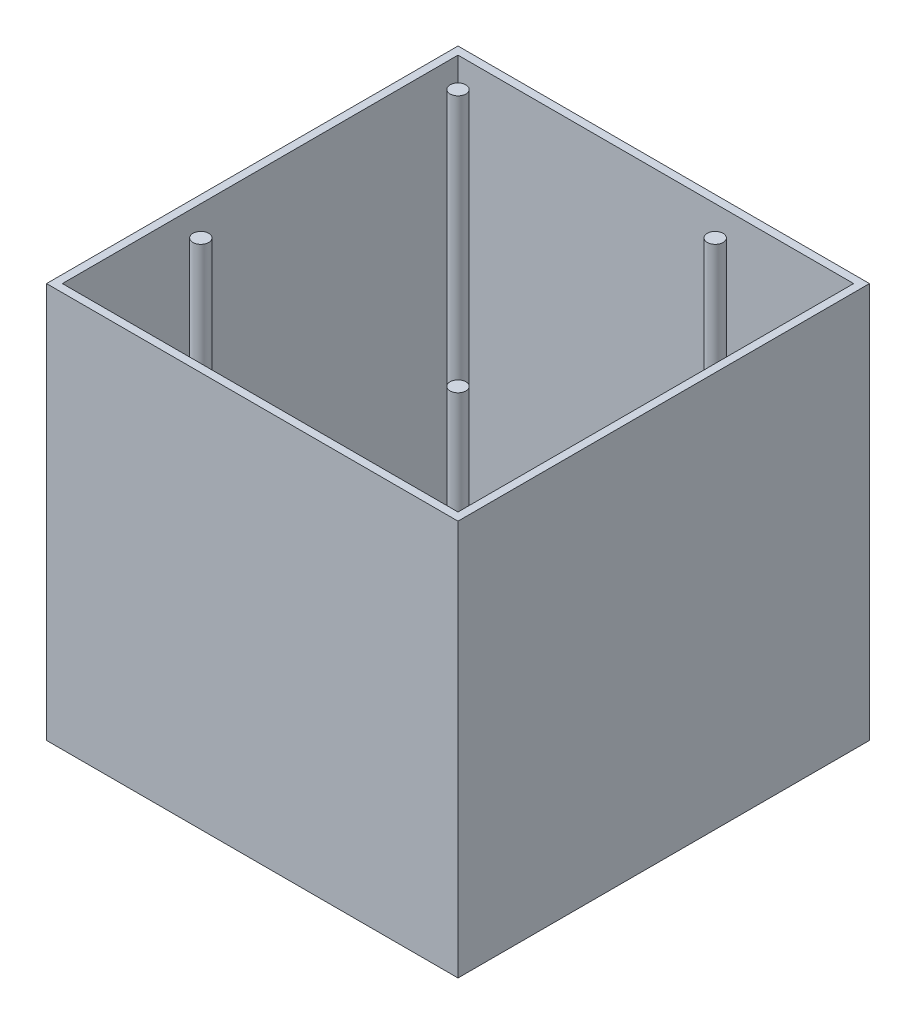
from build123d import *

# Parameters (mm, degrees)
SKETCH1_W                                  = 208
SKETCH1_H                                  = 208
SKETCH1_W_2                                = 200
SKETCH1_H_2                                = 200
BOSS_EXTRUDE1_DEPTH                        = 200
SKETCH3_W                                  = 40
SKETCH3_H                                  = 80
CUT_EXTRUDE1_DEPTH                         = 249.257930387
SKETCH4_W                                  = 144
SKETCH4_H                                  = 144
BOSS_EXTRUDE3_DEPTH                        = 5
BOSS_EXTRUDE4_DEPTH                        = 5
SKETCH4_5_R                                = 4
BOSS_EXTRUDE5_DEPTH                        = 210
BOSS_EXTRUDE5_DIRECTION_2_REACH            = 242.275
MIRROR2_OUTLINE_R                          = 4
MIRROR2_DEPTH                              = 220
MIRROR2_2_OUTLINE_R                        = 4
MIRROR2_2_DEPTH                            = 5
SKETCH8_R                                  = 10
BOSS_EXTRUDE7_DEPTH                        = 25
CUT_EXTRUDE3_DEPTH                         = 265.635598512
CUT_EXTRUDE3_DEPTH_BACK                    = 265.635598512
SKETCH11_R                                 = 5
CUT_EXTRUDE4_DEPTH                         = 245.247824965
SKETCH12_R                                 = 4.3
CUT_EXTRUDE5_DEPTH                         = 257.382526706
MIRROR3_AT_THE_SECOND_PLANE_COPY_1_SKETC_R = 4.3
MIRROR3_AT_THE_SECOND_PLANE_COPY_1_DEPTH   = 257.382526706


# Read off the part's stored shape, not the designer's step: Mirror2
with BuildPart() as part:
    # Sketch1 → Boss-Extrude1 (new body)
    with BuildSketch(Plane(origin=(0, 0, 0), x_dir=(1, 0, 0), z_dir=(0, 1, 0))):
        Rectangle(SKETCH1_W, SKETCH1_H)
        Rectangle(SKETCH1_W_2, SKETCH1_H_2, mode=Mode.SUBTRACT)
    extrude(amount=BOSS_EXTRUDE1_DEPTH)

    # Sketch3 → Cut-Extrude1 (cut, through all)
    with BuildSketch(Plane.XY):
        with Locations((0, 40)):
            Rectangle(SKETCH3_W, SKETCH3_H)
    extrude(amount=-CUT_EXTRUDE1_DEPTH, mode=Mode.SUBTRACT)

    # Sketch5 → Boss-Extrude4 (add)
    with BuildSketch(Plane(origin=(0, 0, 0), x_dir=(1, 0, 0), z_dir=(0, 1, 0))):
        with BuildLine():
            Line((90, 100), (59.468591297, 70.779577645))
            ThreePointArc((59.468591297, 70.779577645), (59.343145751, 59.343145751), (70.779577645, 59.468591297))
            Line((70.779577645, 59.468591297), (100, 90))
            Line((100, 90), (100, 100))
            Line((100, 100), (90, 100))
        make_face()
    extrude(amount=BOSS_EXTRUDE4_DEPTH)

    # Sketch4<5> → Boss-Extrude5 (add)
    with BuildSketch(Plane(origin=(0, 10, 0), x_dir=(1, 0, 0), z_dir=(0, 1, 0))):
        with Locations(Location((65, 65, 0), (0, 0, 270))):
            Circle(SKETCH4_5_R)
    extrude(amount=BOSS_EXTRUDE5_DEPTH)

    # Sketch4<5> → Boss-Extrude5 direction 2 (add, up to next)
    with BuildSketch(Plane(origin=(0, 10, 0), x_dir=(1, 0, 0), z_dir=(0, 1, 0)), mode=Mode.PRIVATE) as boss_extrude5_direction_2_sk1:
        with Locations(Location((65, 65, 0), (0, 0, 270))):
            Circle(SKETCH4_5_R)
    boss_extrude5_direction_2_tool1 = extrude(boss_extrude5_direction_2_sk1.sketch, amount=-BOSS_EXTRUDE5_DIRECTION_2_REACH, mode=Mode.PRIVATE) - part.part
    add(boss_extrude5_direction_2_tool1.solids().sort_by_distance((65, 10, -65))[0])



with BuildPart() as body_2:
    # Sketch4 → Boss-Extrude3 (new body)
    with BuildSketch(Plane(origin=(0, 10, 0), x_dir=(1, 0, 0), z_dir=(0, 1, 0))):
        Rectangle(SKETCH4_W, SKETCH4_H)
    extrude(amount=-BOSS_EXTRUDE3_DEPTH)

    # Sketch8 → Boss-Extrude7 (add, through all)
    with BuildSketch(Plane(origin=(0, 25, 0), x_dir=(1, 0, 0), z_dir=(0, 1, 0))):
        with Locations((0, 82)):
            Circle(SKETCH8_R)
        with BuildLine():
            Line((-10, 82), (-10, 57))
            Line((-10, 57), (10, 57))
            Line((10, 57), (10, 82))
            ThreePointArc((10, 82), (0, 72), (-10, 82))
        make_face()
    extrude(amount=-BOSS_EXTRUDE7_DEPTH)

    # Sketch10 → Cut-Extrude3 (cut, two sides: drawn at the far end of the back side and taken through both)
    with BuildSketch(Plane(origin=(0, 0, 0), x_dir=(0, 0, -1), z_dir=(1, 0, 0)).offset(-CUT_EXTRUDE3_DEPTH_BACK)):
        Polygon((665.474932894, 20), (92, 20), (72, 20), (72, 0), (72, -573.474932894), (883.01602778, -1384.490960674), (1476.490960674, -791.01602778), align=None)
    extrude(amount=CUT_EXTRUDE3_DEPTH + CUT_EXTRUDE3_DEPTH_BACK, mode=Mode.SUBTRACT)

    # Sketch11 → Cut-Extrude4 (cut, through all)
    with BuildSketch(Plane(origin=(0, 25, 0), x_dir=(1, 0, 0), z_dir=(0, 1, 0))):
        with Locations(Location((0, 82, 0), (0, 0, 270))):
            Circle(SKETCH11_R)
    extrude(amount=-CUT_EXTRUDE4_DEPTH, mode=Mode.SUBTRACT)

    # Sketch12 → Cut-Extrude5 (cut, through all)
    with BuildSketch(Plane(origin=(0, 10, 0), x_dir=(1, 0, 0), z_dir=(0, 1, 0))):
        with Locations(Location((65, 65, 0), (0, 0, 270))):
            Circle(SKETCH12_R)
    cut_extrude5 = extrude(amount=-CUT_EXTRUDE5_DEPTH, mode=Mode.SUBTRACT)

    # Mirror3: Cut-Extrude5 across plane
    add(cut_extrude5.mirror(Plane.XY), mode=Mode.SUBTRACT)

    # Mirror3 at the second plane: Cut-Extrude5 across plane
    add(cut_extrude5.mirror(Plane(origin=(0, 0, 0), x_dir=(0, 0, 1), z_dir=(1, 0, 0))), mode=Mode.SUBTRACT)

    # Mirror3 at the second plane copy 1 sketc → Mirror3 at the second plane copy 1 (cut, through all)
    with BuildSketch(Plane(origin=(0, 10, 0), x_dir=(-1, 0, 0), z_dir=(0, 1, 0))):
        with Locations(Location((65, 65, 0), (0, 0, 270))):
            Circle(MIRROR3_AT_THE_SECOND_PLANE_COPY_1_SKETC_R)
    extrude(amount=-MIRROR3_AT_THE_SECOND_PLANE_COPY_1_DEPTH, mode=Mode.SUBTRACT)


with BuildPart() as body_3:
    # Mirror2 outline → Mirror2 (new body)
    with BuildSketch(Plane(origin=(0, 0, 0), x_dir=(1, 0, 0), z_dir=(0, 1, 0))):
        with Locations((65, -65)):
            Circle(MIRROR2_OUTLINE_R)
        with Locations((-65, 65)):
            Circle(MIRROR2_OUTLINE_R)
        with Locations((-65, -65)):
            Circle(MIRROR2_OUTLINE_R)
    extrude(amount=MIRROR2_DEPTH)


with BuildPart() as part_1:
    add(part.part)

    add(body_3.part)  # Mirror2 2 merges body 3
    # Mirror2 2 outline → Mirror2 2 (add)
    # profile 1 of 3: a face of its own
    with BuildSketch(Plane(origin=(0, 0, 0), x_dir=(1, 0, 0), z_dir=(0, 1, 0))):
        with BuildLine():
            ThreePointArc((70.779577645, -59.468591297), (59.343145751, -59.343145751), (59.468591297, -70.779577645))
            Line((59.468591297, -70.779577645), (90, -100))
            Line((90, -100), (100, -100))
            Line((100, -100), (100, -90))
            Line((100, -90), (70.779577645, -59.468591297))
        make_face()
        with Locations((65, -65)):
            Circle(MIRROR2_2_OUTLINE_R, mode=Mode.SUBTRACT)
    # profile 2 of 3: a face of its own
    with BuildSketch(Plane(origin=(0, 0, 0), x_dir=(1, 0, 0), z_dir=(0, 1, 0))):
        with BuildLine():
            Line((-100, -100), (-90, -100))
            Line((-90, -100), (-59.468591297, -70.779577645))
            ThreePointArc((-59.468591297, -70.779577645), (-59.343145751, -59.343145751), (-70.779577645, -59.468591297))
            Line((-70.779577645, -59.468591297), (-100, -90))
            Line((-100, -90), (-100, -100))
        make_face()
        with Locations((-65, -65)):
            Circle(MIRROR2_2_OUTLINE_R, mode=Mode.SUBTRACT)
    # profile 3 of 3: a face of its own
    with BuildSketch(Plane(origin=(0, 0, 0), x_dir=(1, 0, 0), z_dir=(0, 1, 0))):
        with BuildLine():
            Line((-59.468591297, 70.779577645), (-90, 100))
            Line((-90, 100), (-100, 100))
            Line((-100, 100), (-100, 90))
            Line((-100, 90), (-70.779577645, 59.468591297))
            ThreePointArc((-70.779577645, 59.468591297), (-59.343145751, 59.343145751), (-59.468591297, 70.779577645))
        make_face()
        with Locations((-65, 65)):
            Circle(MIRROR2_2_OUTLINE_R, mode=Mode.SUBTRACT)
    extrude(amount=MIRROR2_2_DEPTH)


solid = Compound([body_2.part, part_1.part])
